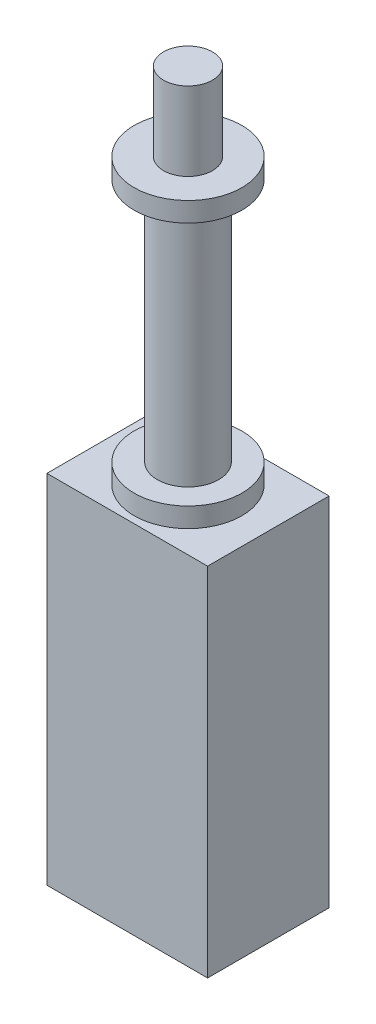
from build123d import *

# Parameters (mm, degrees)
SKETCH1_R      = 34.925
EXTRUDE1_DEPTH = 12.7
SKETCH2_R      = 19.86600399
EXTRUDE2_DEPTH = 184.15
SKETCH3_R      = 15.875
EXTRUDE3_DEPTH = 50.8
EXTRUDE4_START = -12.7
SKETCH4_R      = 34.925
EXTRUDE4_DEPTH = 12.7
SKETCH5_W      = 104.14
SKETCH5_H      = 78.74
EXTRUDE5_DEPTH = 231.14


with BuildPart() as part:
    # Sketch1 → Extrude1 (new body)
    with BuildSketch(Plane(origin=(0, 0, 0), x_dir=(1, 0, 0), z_dir=(0, 1, 0))):
        Circle(SKETCH1_R)
    extrude(amount=-EXTRUDE1_DEPTH)

    # Sketch2 → Extrude2 (add)
    with BuildSketch(Plane(origin=(0, 0, 0), x_dir=(1, 0, 0), z_dir=(0, 1, 0))):
        Circle(SKETCH2_R)
    extrude(amount=-EXTRUDE2_DEPTH)

    # Sketch3 → Extrude3 (add)
    with BuildSketch(Plane(origin=(0, 0, 0), x_dir=(1, 0, 0), z_dir=(0, 1, 0))):
        Circle(SKETCH3_R)
    extrude(amount=EXTRUDE3_DEPTH)

    # Sketch4 → Extrude4 (add)
    with BuildSketch(Plane.XZ.offset(184.15).offset(EXTRUDE4_START)):
        Circle(SKETCH4_R)
    extrude(amount=EXTRUDE4_DEPTH)

    # Sketch5 → Extrude5 (add)
    with BuildSketch(Plane.XZ.offset(184.15)):
        Rectangle(SKETCH5_W, SKETCH5_H)
    extrude(amount=EXTRUDE5_DEPTH)


solid = part.part
